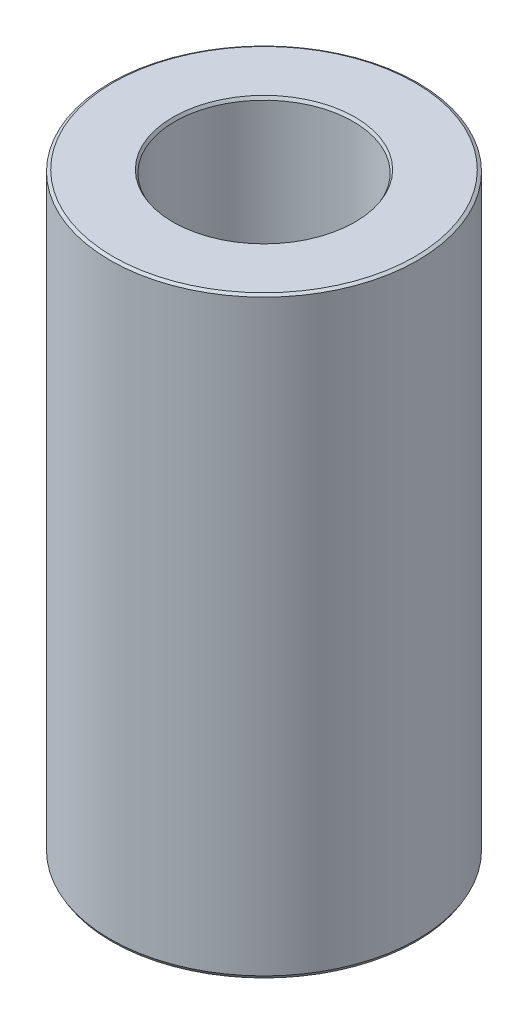
from build123d import *
from OCP.BRepFilletAPI import BRepFilletAPI_MakeChamfer

# Parameters (mm, degrees)
SKETCH1_R           = 57.5
BOSS_EXTRUDE1_DEPTH = 221.507115147
SKETCH2_R           = 33.364378707
CUT_EXTRUDE1_DEPTH  = 236.961653793
CHAMFER1_SIZE       = 0.644498012
CHAMFER1_SIZE2      = 1.116303303


with BuildPart() as part:
    # Sketch1 → Boss-Extrude1 (new body)
    with BuildSketch(Plane(origin=(0, 0, 0), x_dir=(1, 0, 0), z_dir=(0, 1, 0))):
        Circle(SKETCH1_R)
    extrude(amount=BOSS_EXTRUDE1_DEPTH)

    # Sketch2 → Cut-Extrude1 (cut, through all)
    with BuildSketch(Plane(origin=(0, 0, 0), x_dir=(1, 0, 0), z_dir=(0, 1, 0))):
        Circle(SKETCH2_R)
    extrude(amount=CUT_EXTRUDE1_DEPTH, mode=Mode.SUBTRACT)

    # Chamfer1: one chamfer whose edges measure the first distance from different faces: ONE call of the kernel's chamfer builder (chamfer() names one face for all edges)
    chamfer1_edges_1 = [part.edges().sort_by_distance(p)[0] for p in [
        (-33.364378707, 221.507115147, 0),
    ]]
    chamfer1_side_1 = [part.faces().sort_by_distance(p)[0] for p in [
        (-55.873654403, 221.507115147, 0),
    ]]
    chamfer1_edges_2 = [part.edges().sort_by_distance(p)[0] for p in [
        (-33.364378707, 0, 0),
    ]]
    chamfer1_side_2 = [part.faces().sort_by_distance(p)[0] for p in [
        (-33.364378707, 110.753557574, 0),
    ]]
    chamfer1_edges_3 = [part.edges().sort_by_distance(p)[0] for p in [
        (-57.5, 0, 0),
    ]]
    chamfer1_side_3 = [part.faces().sort_by_distance(p)[0] for p in [
        (-55.873654403, 0, 0),
    ]]
    chamfer1_edges_4 = [part.edges().sort_by_distance(p)[0] for p in [
        (-57.5, 221.507115147, 0),
    ]]
    chamfer1_side_4 = [part.faces().sort_by_distance(p)[0] for p in [
        (-57.5, 110.753557574, 0),
    ]]
    chamfer1 = BRepFilletAPI_MakeChamfer(part.part.solid().wrapped)
    for e in chamfer1_edges_1:
        chamfer1.Add(CHAMFER1_SIZE, CHAMFER1_SIZE2, e.wrapped, chamfer1_side_1[0].wrapped)  # the first distance lies on this face
    for e in chamfer1_edges_2:
        chamfer1.Add(CHAMFER1_SIZE, CHAMFER1_SIZE2, e.wrapped, chamfer1_side_2[0].wrapped)  # the first distance lies on this face
    for e in chamfer1_edges_3:
        chamfer1.Add(CHAMFER1_SIZE, CHAMFER1_SIZE2, e.wrapped, chamfer1_side_3[0].wrapped)  # the first distance lies on this face
    for e in chamfer1_edges_4:
        chamfer1.Add(CHAMFER1_SIZE, CHAMFER1_SIZE2, e.wrapped, chamfer1_side_4[0].wrapped)  # the first distance lies on this face
    add(Compound.cast(chamfer1.Shape()), mode=Mode.REPLACE)


solid = part.part
